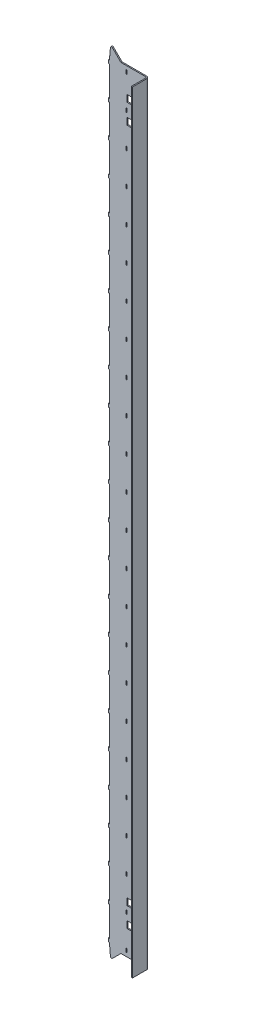
from build123d import *

# Parameters (mm, degrees)
SKETCH_1_W                       = 35
SKETCH_1_H                       = 700
SM_BASE_FLANGE_1_DEPTH           = 1
SM_EDGE_FLANGE_1_STRIP_W         = 6
SM_EDGE_FLANGE_1_STRIP_H         = 1
SM_EDGE_FLANGE_1_STRIP_CUT_DEPTH = 700
SM_EDGE_FLANGE_1_DEPTH           = 700
SM_BASE_FLANGE_1_2_DEPTH         = 1
FILLET_1_R                       = 1
SKETCH_12_W                      = 1.2
SKETCH_12_H                      = 3.5
CUT_EXTRUDE_1_DEPTH              = 361.077539991
SKETCH_13_W                      = 1
SKETCH_13_H                      = 3
SM_BASE_FLANGE_2_DEPTH           = 1
SKETCH_14_W                      = 8.2
SKETCH_14_H                      = 6.2
CUT_EXTRUDE_2_DEPTH              = 10


# Sheet-metal steps are written as plain solids
with BuildPart() as part:
    # Sketch 1 → Sm Base Flange 1 (new body)
    with BuildSketch(Plane.XY):
        with Locations((17.5, 0)):
            Rectangle(SKETCH_1_W, SKETCH_1_H)
    extrude(amount=-SM_BASE_FLANGE_1_DEPTH)

    # Ребро-кромка1 strip (across the edge) → Ребро-кромка1 strip cut (cut)
    with BuildSketch(Plane(origin=(35, -350, 0), x_dir=(-1, 0, 0), z_dir=(0, 1, 0))):
        with Locations((-1, -0.5)):
            Rectangle(SM_EDGE_FLANGE_1_STRIP_W, SM_EDGE_FLANGE_1_STRIP_H)
    extrude(amount=SM_EDGE_FLANGE_1_STRIP_CUT_DEPTH, mode=Mode.SUBTRACT)

    # Ребро-кромка1 section (across the edge) → Ребро-кромка1 (add)
    with BuildSketch(Plane(origin=(35, -350, 0), x_dir=(-1, 0, 0), z_dir=(0, 1, 0))):
        with BuildLine():
            Line((0, 1), (0, 14))
            Line((0, 14), (1, 14))
            Line((1, 14), (1, 1))
            ThreePointArc((1, 1), (1.292893219, 0.292893219), (2, 0))
            Line((2, 0), (2, -1))
            ThreePointArc((2, -1), (0.585786438, -0.414213562), (0, 1))
        make_face()
    extrude(amount=SM_EDGE_FLANGE_1_DEPTH)

    # Эскиз9 → Sm Base Flange 1 2 (add)
    with BuildSketch(Plane(origin=(0, 0, -1), x_dir=(-1, 0, 0), z_dir=(0, 0, -1))):
        with BuildLine():
            Line((-1.367567053, 359.132432947), (-10.5, 350))
            Line((-10.5, 350), (-0.5, 350))
            ThreePointArc((-0.5, 350), (-0.717378914, 354.586774578), (-1.367567053, 359.132432947))
        make_face()
        with BuildLine():
            Line((-10.5, -350), (-0.5, -350))
            ThreePointArc((-0.5, -350), (-0.717378914, -354.586774578), (-1.367567053, -359.132432947))
            Line((-1.367567053, -359.132432947), (-10.5, -350))
        make_face()
    extrude(amount=-SM_BASE_FLANGE_1_2_DEPTH)

    # Скругление1
    fillet_1_edges = [part.edges().sort_by_distance(p)[0] for p in [
        (1.367567053, 359.132432947, -0.5),
        (1.367567053, -359.132432947, -0.5),
    ]]
    fillet(fillet_1_edges, radius=FILLET_1_R)

    # Эскиз12 → Вырез-Вытянуть1 (cut, through all)
    with BuildSketch(Plane(origin=(0, 0, -1), x_dir=(-1, 0, 0), z_dir=(0, 0, -1))):
        with Locations((-15.5, 45)):
            Rectangle(SKETCH_12_W, SKETCH_12_H)
        with Locations((-15.5, 15)):
            Rectangle(SKETCH_12_W, SKETCH_12_H)
        with Locations((-15.5, 75)):
            Rectangle(SKETCH_12_W, SKETCH_12_H)
        with Locations((-15.5, 105)):
            Rectangle(SKETCH_12_W, SKETCH_12_H)
        with Locations((-15.5, 135)):
            Rectangle(SKETCH_12_W, SKETCH_12_H)
        with Locations((-15.5, 165)):
            Rectangle(SKETCH_12_W, SKETCH_12_H)
        with Locations((-15.5, 195)):
            Rectangle(SKETCH_12_W, SKETCH_12_H)
        with Locations((-15.5, 225)):
            Rectangle(SKETCH_12_W, SKETCH_12_H)
        with Locations((-15.5, 255)):
            Rectangle(SKETCH_12_W, SKETCH_12_H)
        with Locations((-15.5, 285)):
            Rectangle(SKETCH_12_W, SKETCH_12_H)
        with Locations((-15.5, 315)):
            Rectangle(SKETCH_12_W, SKETCH_12_H)
        with Locations((-15.5, 345)):
            Rectangle(SKETCH_12_W, SKETCH_12_H)
        with Locations((-15.5, -345)):
            Rectangle(SKETCH_12_W, SKETCH_12_H)
        with Locations((-15.5, -315)):
            Rectangle(SKETCH_12_W, SKETCH_12_H)
        with Locations((-15.5, -285)):
            Rectangle(SKETCH_12_W, SKETCH_12_H)
        with Locations((-15.5, -255)):
            Rectangle(SKETCH_12_W, SKETCH_12_H)
        with Locations((-15.5, -225)):
            Rectangle(SKETCH_12_W, SKETCH_12_H)
        with Locations((-15.5, -195)):
            Rectangle(SKETCH_12_W, SKETCH_12_H)
        with Locations((-15.5, -165)):
            Rectangle(SKETCH_12_W, SKETCH_12_H)
        with Locations((-15.5, -135)):
            Rectangle(SKETCH_12_W, SKETCH_12_H)
        with Locations((-15.5, -105)):
            Rectangle(SKETCH_12_W, SKETCH_12_H)
        with Locations((-15.5, -75)):
            Rectangle(SKETCH_12_W, SKETCH_12_H)
        with Locations((-15.5, -45)):
            Rectangle(SKETCH_12_W, SKETCH_12_H)
        with Locations((-15.5, -15)):
            Rectangle(SKETCH_12_W, SKETCH_12_H)
    extrude(amount=-CUT_EXTRUDE_1_DEPTH, mode=Mode.SUBTRACT)

    # Эскиз13 → Выступ2 (add)
    with BuildSketch(Plane.XY):
        with Locations((-0.5, 15)):
            Rectangle(SKETCH_13_W, SKETCH_13_H)
        with Locations((-0.5, 45)):
            Rectangle(SKETCH_13_W, SKETCH_13_H)
        with Locations((-0.5, 75)):
            Rectangle(SKETCH_13_W, SKETCH_13_H)
        with Locations((-0.5, 105)):
            Rectangle(SKETCH_13_W, SKETCH_13_H)
        with Locations((-0.5, 135)):
            Rectangle(SKETCH_13_W, SKETCH_13_H)
        with Locations((-0.5, 165)):
            Rectangle(SKETCH_13_W, SKETCH_13_H)
        with Locations((-0.5, 195)):
            Rectangle(SKETCH_13_W, SKETCH_13_H)
        with Locations((-0.5, 225)):
            Rectangle(SKETCH_13_W, SKETCH_13_H)
        with Locations((-0.5, 255)):
            Rectangle(SKETCH_13_W, SKETCH_13_H)
        with Locations((-0.5, 285)):
            Rectangle(SKETCH_13_W, SKETCH_13_H)
        with Locations((-0.5, 315)):
            Rectangle(SKETCH_13_W, SKETCH_13_H)
        with Locations((-0.5, 345)):
            Rectangle(SKETCH_13_W, SKETCH_13_H)
        with Locations((-0.5, -345)):
            Rectangle(SKETCH_13_W, SKETCH_13_H)
        with Locations((-0.5, -315)):
            Rectangle(SKETCH_13_W, SKETCH_13_H)
        with Locations((-0.5, -285)):
            Rectangle(SKETCH_13_W, SKETCH_13_H)
        with Locations((-0.5, -255)):
            Rectangle(SKETCH_13_W, SKETCH_13_H)
        with Locations((-0.5, -225)):
            Rectangle(SKETCH_13_W, SKETCH_13_H)
        with Locations((-0.5, -195)):
            Rectangle(SKETCH_13_W, SKETCH_13_H)
        with Locations((-0.5, -165)):
            Rectangle(SKETCH_13_W, SKETCH_13_H)
        with Locations((-0.5, -135)):
            Rectangle(SKETCH_13_W, SKETCH_13_H)
        with Locations((-0.5, -105)):
            Rectangle(SKETCH_13_W, SKETCH_13_H)
        with Locations((-0.5, -75)):
            Rectangle(SKETCH_13_W, SKETCH_13_H)
        with Locations((-0.5, -45)):
            Rectangle(SKETCH_13_W, SKETCH_13_H)
        with Locations((-0.5, -15)):
            Rectangle(SKETCH_13_W, SKETCH_13_H)
    extrude(amount=-SM_BASE_FLANGE_2_DEPTH)

    # Эскиз14 → Вырез-Вытянуть2 (cut)
    with BuildSketch(Plane(origin=(0, 0, -1), x_dir=(-1, 0, 0), z_dir=(0, 0, -1))):
        with Locations((-20, 306.55)):
            Rectangle(SKETCH_14_W, SKETCH_14_H)
        with Locations((-20, 324.55)):
            Rectangle(SKETCH_14_W, SKETCH_14_H)
        with Locations((-20, -306.55)):
            Rectangle(SKETCH_14_W, SKETCH_14_H)
        with Locations((-20, -324.55)):
            Rectangle(SKETCH_14_W, SKETCH_14_H)
    extrude(amount=-CUT_EXTRUDE_2_DEPTH, mode=Mode.SUBTRACT)


solid = part.part
